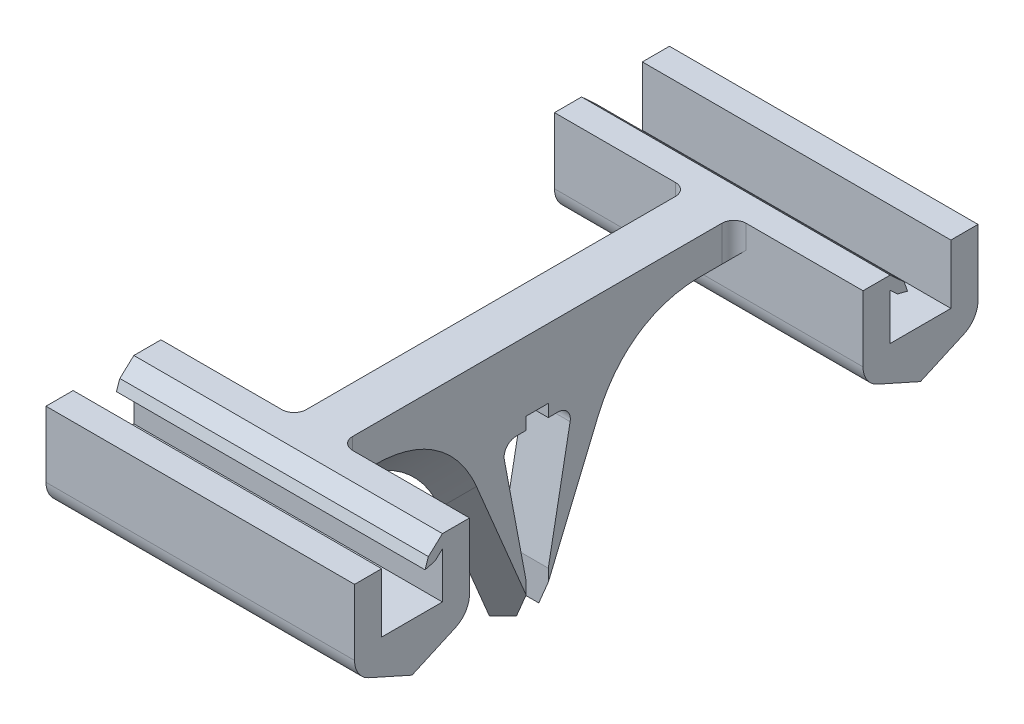
from build123d import *

# Parameters (mm, degrees)
BOSS_EXTRUDE1_DEPTH   = 12.7
BOSS_EXTRUDE1_2_DEPTH = 12.7
BOSS_EXTRUDE2_REACH   = 26.909
CUT_EXTRUDE2_REACH    = 19.991
FILLET1_R             = 6.35
FILLET3_R             = 0.5


with BuildPart() as part:
    # Sketch1 → Boss-Extrude1 (new body)
    with BuildSketch(Plane(origin=(0, 0, 0), x_dir=(0, 0, -1), z_dir=(1, 0, 0))):
        with BuildLine():
            Line((9.214036359, -0.723419074), (9.52014781, -1.005011796))
            Line((9.52014781, -1.005011796), (9.931084378, -1.111282001))
            Line((9.931084378, -1.111282001), (9.790954894, -0.710625106))
            Line((9.790954894, -0.710625106), (9.214036359, -0.17991624))
            Line((9.214036359, -0.17991624), (8.098182028, -0.17991624))
            Line((8.098182028, -0.17991624), (8.098182028, -2.893389425))
            ThreePointArc((8.098182028, -2.893389425), (8.258948932, -3.437161263), (8.68955765, -3.80609207))
            Line((8.68955765, -3.80609207), (10.464036359, -4.600540583))
            Line((10.464036359, -4.600540583), (12.238515069, -3.80609207))
            ThreePointArc((12.238515069, -3.80609207), (12.669123787, -3.437161263), (12.829890691, -2.893389425))
            Line((12.829890691, -2.893389425), (12.829890691, -0.17991624))
            Line((12.829890691, -0.17991624), (11.714036359, -0.17991624))
            Line((11.714036359, -0.17991624), (11.714036359, -2.617334806))
            Line((11.714036359, -2.617334806), (9.214036359, -2.617334806))
            Line((9.214036359, -2.617334806), (9.214036359, -0.723419074))
        make_face()
    extrude(amount=BOSS_EXTRUDE1_DEPTH)


with BuildPart() as body_2:
    # Sketch1 → Boss-Extrude1 2 (new body)
    with BuildSketch(Plane(origin=(0, 0, 0), x_dir=(0, 0, -1), z_dir=(1, 0, 0))):
        with BuildLine():
            Line((-8.098182028, -0.17991624), (-9.214036359, -0.17991624))
            Line((-9.214036359, -0.17991624), (-9.790954894, -0.710625106))
            Line((-9.790954894, -0.710625106), (-9.931084378, -1.111282001))
            Line((-9.931084378, -1.111282001), (-9.52014781, -1.005011796))
            Line((-9.52014781, -1.005011796), (-9.214036359, -0.723419074))
            Line((-9.214036359, -0.723419074), (-9.214036359, -2.617334806))
            Line((-9.214036359, -2.617334806), (-11.714036359, -2.617334806))
            Line((-11.714036359, -2.617334806), (-11.714036359, -0.17991624))
            Line((-11.714036359, -0.17991624), (-12.829890691, -0.17991624))
            Line((-12.829890691, -0.17991624), (-12.829890691, -2.893389425))
            ThreePointArc((-12.829890691, -2.893389425), (-12.669123787, -3.437161263), (-12.238515069, -3.80609207))
            Line((-12.238515069, -3.80609207), (-10.464036359, -4.600540583))
            Line((-10.464036359, -4.600540583), (-8.68955765, -3.80609207))
            ThreePointArc((-8.68955765, -3.80609207), (-8.258948932, -3.437161263), (-8.098182028, -2.893389425))
            Line((-8.098182028, -2.893389425), (-8.098182028, -0.17991624))
        make_face()
    extrude(amount=BOSS_EXTRUDE1_2_DEPTH)

    # Sketch2 → Boss-Extrude2 (add, up to next)
    with BuildSketch(Plane.XY.offset(-8.098182028), mode=Mode.PRIVATE) as boss_extrude2_sk1:
        Polygon((5.47811731, -0.17991624), (7.387826905, -0.17991624), (7.387826905, -1.641579788), (6.432972108, -2.596434586), (5.47811731, -1.641579788), align=None)
    boss_extrude2_tool1 = extrude(boss_extrude2_sk1.sketch, amount=BOSS_EXTRUDE2_REACH, mode=Mode.PRIVATE) - body_2.part

    add(part.part)  # Boss-Extrude2 merges part
    add(boss_extrude2_tool1.solids().sort_by_distance((6.432972, -1.169053, -8.098182))[0])

    # Sketch5 → Loft4 section 0
    with BuildSketch(Plane(origin=(0, -0.17991624, 0), x_dir=(1, 0, 0), z_dir=(0, 1, 0))):
        with BuildLine():
            Line((7.387826905, 4.313769845), (7.387826905, -4.313769845))
            Line((7.387826905, -4.313769845), (6.432972108, -5.268624642))
            Line((6.432972108, -5.268624642), (5.47811731, -4.313769845))
            Line((5.47811731, -4.313769845), (5.47811731, 4.313769845))
            Line((5.47811731, 4.313769845), (6.432972108, 5.268624642))
            Line((6.432972108, 5.268624642), (7.387826905, 4.313769845))
        make_face()
    # Sketch6 → Loft4 section 1
    with BuildSketch(Plane(origin=(0, -10.33991624, 0), x_dir=(1, 0, 0), z_dir=(0, 1, 0))):
        with BuildLine():
            Line((6.432972108, -1.017808112), (5.47811731, -0.062953314))
            Line((5.47811731, -0.062953314), (5.47811731, 0.062953314))
            Line((5.47811731, 0.062953314), (6.432972108, 1.017808112))
            Line((6.432972108, 1.017808112), (7.387826905, 0.062953314))
            Line((7.387826905, 0.062953314), (7.387826905, -0.062953314))
            Line((7.387826905, -0.062953314), (6.432972108, -1.017808112))
        make_face()
    loft()

    # Sketch4 → Cut-Extrude2 (cut, up to next)
    with BuildSketch(Plane.ZY.offset(-5.47811731), mode=Mode.PRIVATE) as cut_extrude2_sk1:
        with BuildLine():
            Line((0.863271786, -3.536832517), (0.455999977, -3.536832517))
            Line((0.455999977, -3.536832517), (0.455999977, -3.028389789))
            Line((0.455999977, -3.028389789), (-0.455999977, -3.028389789))
            Line((-0.455999977, -3.028389789), (-0.455999977, -3.536832517))
            Line((-0.455999977, -3.536832517), (-0.863271786, -3.536832517))
            ThreePointArc((-0.863271786, -3.536832517), (-1.248147381, -3.717660499), (-1.354637866, -4.129349409))
            Line((-1.354637866, -4.129349409), (-0.455999977, -8.902101345))
            Line((-0.455999977, -8.902101345), (-0.455999977, -12.003161214))
            Line((-0.455999977, -12.003161214), (0.455999977, -12.003161214))
            Line((0.455999977, -12.003161214), (0.455999977, -8.902101345))
            Line((0.455999977, -8.902101345), (1.354637866, -4.129349409))
            ThreePointArc((1.354637866, -4.129349409), (1.248147381, -3.717660499), (0.863271786, -3.536832517))
        make_face()
    cut_extrude2_tool1 = extrude(cut_extrude2_sk1.sketch, amount=-CUT_EXTRUDE2_REACH, mode=Mode.PRIVATE) & body_2.part
    add(cut_extrude2_tool1.solids().sort_by_distance((5.478117, -6.679281, 0))[0], mode=Mode.SUBTRACT)

    # Fillet1
    # the kernel refuses this fillet: 6.35 mm, written as the material it adds along each edge
    with BuildSketch(Plane(origin=(11.918265355, 2.888858661, -1.067268312), x_dir=(0.268949751125616, 0.268949751125617, -0.9248416419792839), z_dir=(-0.6539617965672524, -0.6539617965672533, -0.3803523856387155))) as fillet1_piece_1_section:
        with BuildLine():
            CenterArc((FILLET1_R * 0.436389328948, FILLET1_R), FILLET1_R, 222.8481144, 47.1518856)
            Line((-FILLET1_R * 0.296769712888, FILLET1_R * 0.319942782278), (0, 0))
            Line((0, 0), (FILLET1_R * 0.436389328948, 0))
        make_face()
    fillet1_piece_1 = extrude(amount=15.315469113, mode=Mode.PRIVATE)
    fillet1_piece_1 = split(fillet1_piece_1, bisect_by=Plane(origin=(7.387826905, 2.888858661, -1.067268312), z_dir=(-1, 0, 0)), keep=Keep.TOP, mode=Mode.PRIVATE)
    fillet1_piece_1 = fillet1_piece_1 - Plane(origin=(0.404018799, -5.547737398, -6.35885034), x_dir=(0.7071067811865474, 0.7071067811865479, 0), z_dir=(0.6539617965672531, -0.6539617965672526, -0.38035238563871554)) * Cylinder(6.35, 42, mode=Mode.PRIVATE)
    add(fillet1_piece_1)
    with BuildSketch(Plane(origin=(10.963410557, -7.126873035, -6.892543527), x_dir=(-0.26894975112561653, 0.26894975112561653, -0.9248416419792839), z_dir=(-0.6539617965672532, 0.6539617965672525, 0.38035238563871554))) as fillet1_piece_2_section:
        with BuildLine():
            CenterArc((FILLET1_R * 0.436389328948, FILLET1_R), FILLET1_R, 222.8481144, 47.1518856)
            Line((-FILLET1_R * 0.296769712888, FILLET1_R * 0.319942782278), (0, 0))
            Line((0, 0), (FILLET1_R * 0.436389328948, 0))
        make_face()
    fillet1_piece_2 = extrude(amount=15.315469113, mode=Mode.PRIVATE)
    fillet1_piece_2 = split(fillet1_piece_2, bisect_by=Plane(origin=(5.47811731, -7.126873035, -6.892543527), z_dir=(1, 0, 0)), keep=Keep.TOP, mode=Mode.PRIVATE)
    fillet1_piece_2 = fillet1_piece_2 - Plane(origin=(11.012970172, -6.996692643, -7.201580889), x_dir=(-0.707106781186548, 0.7071067811865471, 0), z_dir=(0.6539617965672524, 0.6539617965672532, 0.38035238563871543)) * Cylinder(6.35, 42, mode=Mode.PRIVATE)
    add(fillet1_piece_2)
    with BuildSketch(Plane(origin=(1.902533659, -7.126873035, 6.892543527), x_dir=(0.33552051071253974, -0.7013229496273355, -0.6289452338774898), z_dir=(0.6539617965672524, 0.6539617965672533, -0.3803523856387155))) as fillet1_piece_3_section:
        with BuildLine():
            CenterArc((FILLET1_R * 0.436389328948, -FILLET1_R), FILLET1_R, 90, 47.1518856)
            Line((-FILLET1_R * 0.296769712888, -FILLET1_R * 0.319942782278), (0, 0))
            Line((0, 0), (FILLET1_R * 0.436389328948, 0))
        make_face()
    fillet1_piece_3 = extrude(amount=15.315469113, mode=Mode.PRIVATE)
    fillet1_piece_3 = split(fillet1_piece_3, bisect_by=Plane(origin=(7.387826905, -7.126873035, 6.892543527), z_dir=(-1, 0, 0)), keep=Keep.TOP, mode=Mode.PRIVATE)
    fillet1_piece_3 = fillet1_piece_3 - Plane(origin=(1.852974044, -6.996692643, 7.201580889), x_dir=(0.7071067811865474, 0.7071067811865479, 0), z_dir=(-0.6539617965672531, 0.6539617965672526, -0.38035238563871554)) * Cylinder(6.35, 42, mode=Mode.PRIVATE)
    add(fillet1_piece_3)
    with BuildSketch(Plane(origin=(0.947678861, 2.888858661, 1.067268313), x_dir=(-0.26894975112561653, 0.26894975112561653, 0.9248416419792839), z_dir=(0.6539617965672532, -0.6539617965672525, 0.38035238563871554))) as fillet1_piece_4_section:
        with BuildLine():
            CenterArc((FILLET1_R * 0.436389328948, FILLET1_R), FILLET1_R, 222.8481144, 47.1518856)
            Line((-FILLET1_R * 0.296769712888, FILLET1_R * 0.319942782278), (0, 0))
            Line((0, 0), (FILLET1_R * 0.436389328948, 0))
        make_face()
    fillet1_piece_4 = extrude(amount=15.315469113, mode=Mode.PRIVATE)
    fillet1_piece_4 = split(fillet1_piece_4, bisect_by=Plane(origin=(5.47811731, 2.888858661, 1.067268313), z_dir=(1, 0, 0)), keep=Keep.TOP, mode=Mode.PRIVATE)
    fillet1_piece_4 = fillet1_piece_4 - Plane(origin=(12.461925417, -5.547737398, 6.35885034), x_dir=(-0.6780560120828721, 0.28369012840869895, -0.6780560120828721), z_dir=(-0.6539617965672524, -0.6539617965672532, 0.3803523856387155)) * Cylinder(6.35, 42, mode=Mode.PRIVATE)
    add(fillet1_piece_4)

    # Fillet3
    fillet3_edges = [body_2.edges().sort_by_distance(p)[0] for p in [
        (7.387826905, -0.910748014, 8.098182028),
        (5.47811731, -0.910748014, 8.098182028),
        (7.387826905, -0.910748014, -8.098182028),
        (5.47811731, -0.910748014, -8.098182028),
    ]]
    fillet(fillet3_edges, radius=FILLET3_R)


solid = body_2.part
